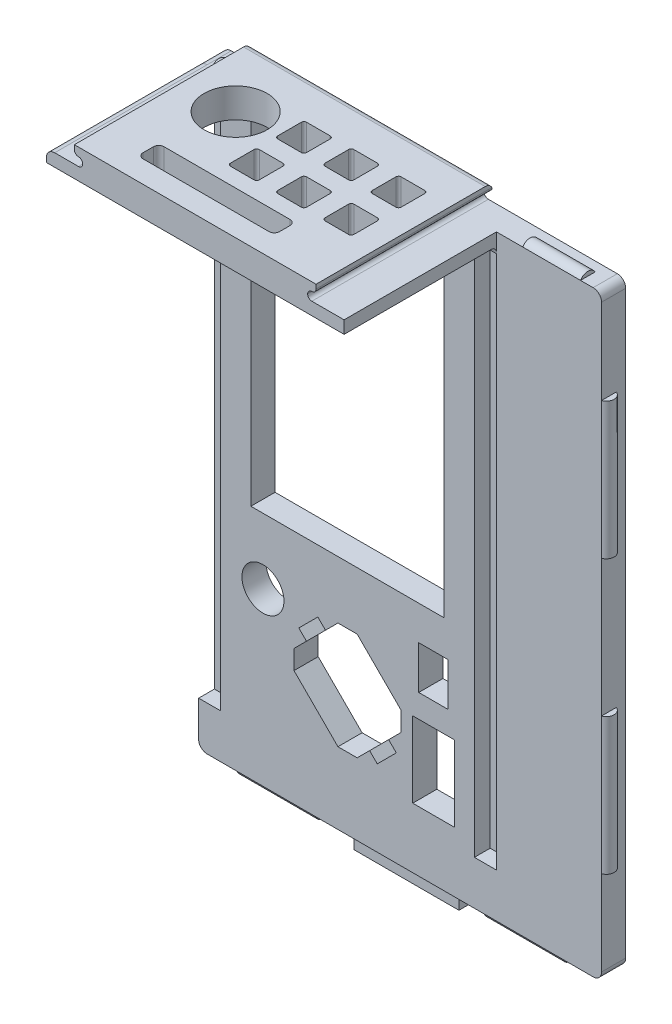
from build123d import *

# Parameters (mm, degrees)
SKETCH_2_W                      = 2.80320188
SKETCH_2_H                      = 4.10319928
SKETCH_2_R                      = 2
SKETCH_2_W_2                    = 3.99999908
SKETCH_2_H_2                    = 7.20319816
EXTRUDE_1_DEPTH                 = 2.3
EXTRUDE_2_DEPTH                 = 14.5
EXTRUDE_2_DEPTH_BACK            = 2.3
SKETCH_3_W                      = 28.34
SKETCH_3_H                      = 3.4
SKETCH_4_R                      = 3
CUT_EXTRUDE_1_DEPTH             = 3.4
SKETCH_2_3_W                    = 2.1
SKETCH_2_3_H                    = 50.8
CUT_EXTRUDE_2_DEPTH             = 1.5
SKETCH_5_W                      = 28.34
SKETCH_5_H                      = 4.2
EXTRUDE_3_DEPTH                 = 2.3
CUT_EXTRUDE_3_REACH             = 71.007
SKETCH_7_W                      = 28.34
SKETCH_7_H                      = 0.6
SKETCH_8_W                      = 13
SKETCH_8_H                      = 2
CUT_EXTRUDE_4_DEPTH             = 2.8
EXTRUDE_5_DEPTH                 = 15.5
EXTRUDE_5_DEPTH_BACK            = 15.5
SKETCH_11_W                     = 3.47
SKETCH_11_H                     = 2.8
CUT_EXTRUDE_5_DEPTH             = 14.5
SKETCH_12_W                     = 3.47
SKETCH_12_H                     = 1.6
SKETCH_12_W_2                   = 13.47
CUT_EXTRUDE_6_DEPTH             = 2.3
EXTRUDE_6_DEPTH                 = 19.5
EXTRUDE_6_DEPTH_BACK            = 19.5
EXTRUDE_7_DEPTH                 = 5.5
EXTRUDE_START                   = -1
EXTRUDE_8_DEPTH                 = 1
FILLET_3_R                      = 0.8
FILLET_4_R                      = 0.5
CUT_EXTRUDE_7_DEPTH             = 6.5
CUT_EXTRUDE_7_DEPTH_BACK        = 6.5
CUT_EXTRUDE_8_DEPTH             = 8
CUT_EXTRUDE_8_DEPTH_BACK        = 8
SKETCH_16_W                     = 10
SKETCH_16_H                     = 1.5
EXTRUDE_9_DEPTH                 = 1.7
FILLET_5_R                      = 0.5
FILLET_6_R                      = 0.5
FILLET_7_R                      = 0.7
SKETCH_18_R                     = 2.4
SKETCH_18_R_2                   = 1.92
SKETCH_18_W                     = 1.228272528
SKETCH_18_H                     = 1.583492732
CUT_EXTRUDE_9_DEPTH             = 0.3
SKETCH_19_W                     = 0.8
SKETCH_19_H                     = 0.8
EXTRUDE_10_DEPTH                = 16.8
FILLET_2_R                      = 0.7
FILLET_8_R                      = 0.4
SKETCH_21_W                     = 3.47
SKETCH_21_H                     = 1.2
EXTRUDE_12_DEPTH                = 14.5
FILLET_10_R                     = 0.4
FILLET_11_R                     = 0.8
FILLET_12_R                     = 0.5
SKETCH_22_W                     = 2.75
SKETCH_22_H                     = 2.75
CUT_EXTRUDE_10_DEPTH            = 2.8
FILLET_13_R                     = 0.25
PATTERN_LINEAR_1_COUNT          = 3
PATTERN_LINEAR_1_PITCH          = 4.5
PATTERN_LINEAR_1_COUNT_DIR2     = 2
PATTERN_LINEAR_1_PITCH_DIR2     = 4.5
FILLET_13_OF_PATTERN_LINEAR_1_R = 0.25
CUT_EXTRUDE_11_DEPTH            = 0.3
FILLET_14_R                     = 0.4


with BuildPart() as part:
    # 草图2 → 凸台-拉伸1 (new body)
    with BuildSketch(Plane.XY):
        Polygon((-0.2, 0), (-0.2, -50.8), (28.14, -50.8), (28.14, 0), (23.17, 0), (23.17, -32.5), (4.77, -32.5), (4.77, 0), align=None)
        with Locations((22.14500143, -37.80800287)):
            Rectangle(SKETCH_2_W, SKETCH_2_H, mode=Mode.SUBTRACT)
        with Locations((5.9182, -38.735)):
            Circle(SKETCH_2_R, mode=Mode.SUBTRACT)
        Polygon((19.066193866, -43.992617401), (17.88030086, -45.178511502), (18.608616214, -45.906826856), (16.798423264, -47.717019806), (16.070108746, -46.988705288), (14.884217409, -48.174597721), (13.055787589, -48.174595399), (8.873804338, -43.992612148), (8.873804338, -42.164191444), (10.05969962, -40.978296162), (9.331380194, -40.249976736), (11.141573144, -38.439783786), (11.86989257, -39.168103212), (13.055787589, -37.982208193), (14.884217273, -37.982205871), (19.066193866, -42.164182464), align=None, mode=Mode.SUBTRACT)
        with Locations((22.16999884, -45.67000137)):
            Rectangle(SKETCH_2_W_2, SKETCH_2_H_2, mode=Mode.SUBTRACT)
    extrude(amount=-EXTRUDE_1_DEPTH)

    # 草图3 → 凸台-拉伸2 (add, two sides: drawn at the far end of the back side and taken through both)
    with BuildSketch(Plane.XY.offset(-EXTRUDE_2_DEPTH_BACK)):
        with Locations((13.97, 1.7)):
            Rectangle(SKETCH_3_W, SKETCH_3_H)
    extrude(amount=EXTRUDE_2_DEPTH + EXTRUDE_2_DEPTH_BACK)

    # 草图4 → 切除-拉伸1 (cut)
    with BuildSketch(Plane(origin=(0, 3.4, 0), x_dir=(1, 0, 0), z_dir=(0, 1, 0))):
        with Locations(Location((7.41680127, -4.1, 0), (0, 0, 270))):
            Circle(SKETCH_4_R)
    extrude(amount=-CUT_EXTRUDE_1_DEPTH, mode=Mode.SUBTRACT)

    # 草图2<3> → 切除-拉伸2 (cut)
    with BuildSketch(Plane.XY):
        with Locations((0.85, -25.4)):
            Rectangle(SKETCH_2_3_W, SKETCH_2_3_H)
        with Locations((27.09, -25.4)):
            Rectangle(SKETCH_2_3_W, SKETCH_2_3_H)
    extrude(amount=-CUT_EXTRUDE_2_DEPTH, mode=Mode.SUBTRACT)

    # 草图5 → 凸台-拉伸3 (add)
    with BuildSketch(Plane.XY):
        Polygon((28.14, 3.4), (28.14, -50.8), (28.14, -55), (38.14, -55), (38.14, 3.4), align=None)
        with Locations((13.97, -52.9)):
            Rectangle(SKETCH_5_W, SKETCH_5_H)
    extrude(amount=-EXTRUDE_3_DEPTH)

    # 切除-拉伸3: up to this face of the body (flat: up to its plane)
    cut_extrude_3_end = Plane(part.part.faces().sort_by_distance((13.97, -33.198606871, 0))[0])
    # 草图7 → 切除-拉伸3 (cut, up to the picked face)
    with BuildSketch(Plane.XY.offset(14.5), mode=Mode.PRIVATE) as cut_extrude_3_sk1:
        with Locations((13.97, 0.3)):
            Rectangle(SKETCH_7_W, SKETCH_7_H)
    cut_extrude_3_tool1 = split(extrude(cut_extrude_3_sk1.sketch, amount=-CUT_EXTRUDE_3_REACH, mode=Mode.PRIVATE), bisect_by=cut_extrude_3_end, keep=Keep.BOTH, mode=Mode.PRIVATE)
    add(cut_extrude_3_tool1.solids().sort_by(Axis((13.97, 0.3, 14.5), (0, 0, -1)))[0], mode=Mode.SUBTRACT)

    # 草图8 → 切除-拉伸4 (cut)
    with BuildSketch(Plane.XZ.offset(-0.6)):
        with Locations((12.9, 11.4)):
            Rectangle(SKETCH_8_W, SKETCH_8_H)
    extrude(amount=-CUT_EXTRUDE_4_DEPTH, mode=Mode.SUBTRACT)

    # 草图9 → 凸台-拉伸5 (add, two sides: drawn at the far end of the back side and taken through both)
    with BuildSketch(Plane(origin=(18.97, 0, 0), x_dir=(0, 0, -1), z_dir=(1, 0, 0)).offset(-EXTRUDE_5_DEPTH_BACK)):
        with BuildLine():
            ThreePointArc((1.4, -55), (0.7, -55.5), (0, -55))
            Line((0, -55), (1.4, -55))
        make_face()
    extrude(amount=EXTRUDE_5_DEPTH + EXTRUDE_5_DEPTH_BACK)

    # 草图11 → 切除-拉伸5 (cut)
    with BuildSketch(Plane.XY.offset(14.5)):
        with Locations((1.535, 2)):
            Rectangle(SKETCH_11_W, SKETCH_11_H)
        with Locations((26.405, 2)):
            Rectangle(SKETCH_11_W, SKETCH_11_H)
    extrude(amount=-CUT_EXTRUDE_5_DEPTH, mode=Mode.SUBTRACT)

    # 草图12 → 切除-拉伸6 (cut)
    with BuildSketch(Plane(origin=(0, 0, -2.3), x_dir=(-1, 0, 0), z_dir=(0, 0, -1))):
        with Locations((-1.535, 2.6)):
            Rectangle(SKETCH_12_W, SKETCH_12_H)
        with Locations((-31.405, 2.6)):
            Rectangle(SKETCH_12_W_2, SKETCH_12_H)
    extrude(amount=-CUT_EXTRUDE_6_DEPTH, mode=Mode.SUBTRACT)

    # 草图10 → 凸台-拉伸6 (add, two sides: drawn at the far end of the back side and taken through both)
    with BuildSketch(Plane(origin=(0, -26.6, 0), x_dir=(1, 0, 0), z_dir=(0, 1, 0)).offset(-EXTRUDE_6_DEPTH_BACK)):
        with BuildLine():
            Line((38.14, 1.4), (38.14, 0))
            ThreePointArc((38.14, 0), (38.64, 0.7), (38.14, 1.4))
        make_face()
    extrude(amount=EXTRUDE_6_DEPTH + EXTRUDE_6_DEPTH_BACK)

    # 草图14 → 凸台-拉伸7 (add)
    with BuildSketch(Plane(origin=(36.14, 0, 0), x_dir=(0, 0, -1), z_dir=(1, 0, 0))):
        with BuildLine():
            Line((0, 1.8), (1.4, 1.8))
            ThreePointArc((1.4, 1.8), (0.7, 2.2), (0, 1.8))
        make_face()
    extrude(amount=-EXTRUDE_7_DEPTH)

    # 草图15 → 凸台-拉伸8 (add)
    with BuildSketch(Plane.ZY.offset(-1.05).offset(EXTRUDE_START)):
        with BuildLine():
            Line((-1.4, 1.8), (0, 1.8))
            ThreePointArc((0, 1.8), (-0.7, 2.2), (-1.4, 1.8))
        make_face()
    extrude(amount=EXTRUDE_8_DEPTH)

    # 圆角3
    fillet_3_edges = [part.edges().sort_by_distance(p)[0] for p in [
        (-0.2, -55, -1.15),
        (38.14, -55, -1.15),
        (-0.2, 1.8, -1.15),
        (38.14, 1.8, -1.15),
    ]]
    fillet(fillet_3_edges, radius=FILLET_3_R)

    # 圆角4
    fillet_4_edges = [part.edges().sort_by_distance(p)[0] for p in [
        (19.4, 2, 10.4),
        (19.4, 2, 12.4),
        (6.4, 2, 12.4),
        (6.4, 2, 10.4),
    ]]
    fillet(fillet_4_edges, radius=FILLET_4_R)

    # 草图10<2> → 切除-拉伸7 (cut, two sides: drawn at the far end of the back side and taken through both)
    with BuildSketch(Plane(origin=(0, -26.6, 0), x_dir=(1, 0, 0), z_dir=(0, 1, 0)).offset(-CUT_EXTRUDE_7_DEPTH_BACK)):
        with BuildLine():
            Line((38.14, 1.4), (38.14, 0))
            ThreePointArc((38.14, 0), (38.64, 0.7), (38.14, 1.4))
        make_face()
    extrude(amount=CUT_EXTRUDE_7_DEPTH + CUT_EXTRUDE_7_DEPTH_BACK, mode=Mode.SUBTRACT)

    # 草图9<3> → 切除-拉伸8 (cut, two sides: drawn at the far end of the back side and taken through both)
    with BuildSketch(Plane(origin=(18.97, 0, 0), x_dir=(0, 0, -1), z_dir=(1, 0, 0)).offset(-CUT_EXTRUDE_8_DEPTH_BACK)):
        with BuildLine():
            Line((0, -55), (1.4, -55))
            ThreePointArc((1.4, -55), (0.7, -55.5), (0, -55))
        make_face()
    extrude(amount=CUT_EXTRUDE_8_DEPTH + CUT_EXTRUDE_8_DEPTH_BACK, mode=Mode.SUBTRACT)

    # 草图16 → 凸台-拉伸9 (add)
    with BuildSketch(Plane(origin=(0, 0, -2.3), x_dir=(-1, 0, 0), z_dir=(0, 0, -1))):
        with Locations((-18.97, -55.75)):
            Rectangle(SKETCH_16_W, SKETCH_16_H)
    extrude(amount=-EXTRUDE_9_DEPTH)

    # 圆角5
    fillet_5_edges = [part.edges().sort_by_distance(p)[0] for p in [
        (18.97, -55, -0.6),
    ]]
    fillet(fillet_5_edges, radius=FILLET_5_R)

    # 圆角6
    fillet_6_edges = [part.edges().sort_by_distance(p)[0] for p in [
        (13.97, -55, -1.2),
        (23.97, -55, -1.2),
    ]]
    fillet(fillet_6_edges, radius=FILLET_6_R)

    # 圆角7
    fillet_7_edges = [part.edges().sort_by_distance(p)[0] for p in [
        (18.97, -56.5, -2.3),
    ]]
    fillet(fillet_7_edges, radius=FILLET_7_R)

    # 草图18 → 切除-拉伸9 (cut)
    # profile 1 of 13: a face of its own
    with BuildSketch(Plane(origin=(0, 0, -2.3), x_dir=(-1, 0, 0), z_dir=(0, 0, -1))):
        with Locations((-29.127267398, -16.25)):
            Circle(SKETCH_18_R)
        with Locations((-29.127267398, -16.25)):
            Circle(SKETCH_18_R_2, mode=Mode.SUBTRACT)
    # profile 2 of 13: a face of its own
    with BuildSketch(Plane(origin=(0, 0, -2.3), x_dir=(-1, 0, 0), z_dir=(0, 0, -1))):
        with BuildLine():
            Line((-24.995537207, -11.915295158), (-26.327515915, -15.57487658))
            ThreePointArc((-26.327515915, -15.57487658), (-26.18407452, -15.882487643), (-25.876463457, -15.739046249))
            Line((-25.876463457, -15.739046249), (-24.544484749, -12.079464827))
            ThreePointArc((-24.544484749, -12.079464827), (-24.687926144, -11.771853763), (-24.995537207, -11.915295158))
        make_face()
    # profile 3 of 13: a face of its own
    with BuildSketch(Plane(origin=(0, 0, -2.3), x_dir=(-1, 0, 0), z_dir=(0, 0, -1))):
        with BuildLine():
            Line((-33.46197224, -12.118269809), (-29.802390818, -13.450248517))
            ThreePointArc((-29.802390818, -13.450248517), (-29.494779755, -13.306807122), (-29.638221149, -12.999196059))
            Line((-29.638221149, -12.999196059), (-33.297802571, -11.667217351))
            ThreePointArc((-33.297802571, -11.667217351), (-33.605413635, -11.810658746), (-33.46197224, -12.118269809))
        make_face()
    # profile 4 of 13: a face of its own
    with BuildSketch(Plane(origin=(0, 0, -2.3), x_dir=(-1, 0, 0), z_dir=(0, 0, -1))):
        with BuildLine():
            Line((-33.258997589, -20.584704842), (-31.927018881, -16.92512342))
            ThreePointArc((-31.927018881, -16.92512342), (-32.070460276, -16.617512357), (-32.378071339, -16.760953751))
            Line((-32.378071339, -16.760953751), (-33.710050047, -20.420535173))
            ThreePointArc((-33.710050047, -20.420535173), (-33.566608652, -20.728146237), (-33.258997589, -20.584704842))
        make_face()
    # profile 5 of 13: a face of its own
    with BuildSketch(Plane(origin=(0, 0, -2.3), x_dir=(-1, 0, 0), z_dir=(0, 0, -1))):
        with BuildLine():
            Line((-24.792562556, -20.381730191), (-28.452143978, -19.049751483))
            ThreePointArc((-28.452143978, -19.049751483), (-28.759755042, -19.193192878), (-28.616313647, -19.500803941))
            Line((-28.616313647, -19.500803941), (-24.956732225, -20.832782649))
            ThreePointArc((-24.956732225, -20.832782649), (-24.649121162, -20.689341254), (-24.792562556, -20.381730191))
        make_face()
    # profile 6 of 13: a face of its own
    with BuildSketch(Plane(origin=(0, 0, -2.3), x_dir=(-1, 0, 0), z_dir=(0, 0, -1))):
        Polygon((-34.774448204, -25.776760243), (-36.74, -25.776760243), (-36.74, -27.909660224), (-36.372149744, -27.909660224), (-36.372149744, -26.259859721), (-35.889050267, -26.259859721), (-35.889050267, -27.205534842), (-35.549617627, -27.205534842), (-35.549617627, -26.259859721), (-35.121774626, -26.259859721), (-35.121774626, -27.884400121), (-34.774448204, -27.884400121), align=None)
    # profile 7 of 13: a face of its own
    with BuildSketch(Plane(origin=(0, 0, -2.3), x_dir=(-1, 0, 0), z_dir=(0, 0, -1))):
        Polygon((-34.774448204, -24.730044708), (-36.20006529, -23.945402746), (-34.774448204, -23.111819334), (-34.774448204, -22.570305867), (-36.74, -23.759109484), (-36.74, -24.087490828), (-34.774448204, -25.227352994), align=None)
    # profile 8 of 13: a face of its own
    with BuildSketch(Plane(origin=(0, 0, -2.3), x_dir=(-1, 0, 0), z_dir=(0, 0, -1))):
        Polygon((-35.237023847, -19.469628175), (-36.274266843, -19.469628175), (-36.364255962, -19.472785687), (-36.533182903, -19.505939573), (-36.642117099, -19.573826101), (-36.683164767, -19.635397603), (-36.725791192, -19.779064441), (-36.74, -19.981145268), (-36.74, -21.501487742), (-36.733684974, -21.632524528), (-36.702109845, -21.798293957), (-36.642117099, -21.907228153), (-36.602648188, -21.940382039), (-36.468453888, -21.994059758), (-36.274266843, -22.01142608), (-35.237023847, -22.01142608), (-35.151770998, -22.008268567), (-34.9812653, -21.976693437), (-34.870752348, -21.908806909), (-34.82970468, -21.847235407), (-34.787078256, -21.703568569), (-34.774448204, -21.501487742), (-34.774448204, -19.981145268), (-34.779184473, -19.848529726), (-34.810759603, -19.682760297), (-34.870752348, -19.573826101), (-34.91022126, -19.542250972), (-35.044415559, -19.488573252), align=None)
        with Locations((-35.748540941, -20.741316505)):
            Rectangle(SKETCH_18_W, SKETCH_18_H, mode=Mode.SUBTRACT)
    # profile 9 of 13: a face of its own
    with BuildSketch(Plane(origin=(0, 0, -2.3), x_dir=(-1, 0, 0), z_dir=(0, 0, -1))):
        Polygon((-34.774448204, -18.206623004), (-36.078501042, -18.206623004), (-34.774448204, -16.537877423), (-34.774448204, -16.209496079), (-36.74, -16.209496079), (-36.74, -16.645232863), (-35.413844571, -16.645232863), (-36.74, -18.307663418), (-36.74, -18.639202275), (-34.774448204, -18.639202275), align=None)
    # profile 10 of 13: a face of its own
    with BuildSketch(Plane(origin=(0, 0, -2.3), x_dir=(-1, 0, 0), z_dir=(0, 0, -1))):
        Polygon((-34.774448204, -13.383522011), (-36.74, -13.383522011), (-36.74, -15.518000748), (-36.372149744, -15.518000748), (-36.372149744, -13.868200245), (-35.889050267, -13.868200245), (-35.889050267, -14.813875366), (-35.549617627, -14.813875366), (-35.549617627, -13.868200245), (-35.121774626, -13.868200245), (-35.121774626, -15.492740645), (-34.774448204, -15.492740645), align=None)
    # profile 11 of 13: a face of its own
    with BuildSketch(Plane(origin=(0, 0, -2.3), x_dir=(-1, 0, 0), z_dir=(0, 0, -1))):
        Polygon((-34.774448204, -10.559126699), (-36.74, -10.559126699), (-36.74, -12.69202668), (-36.372149744, -12.69202668), (-36.372149744, -11.042226176), (-35.889050267, -11.042226176), (-35.889050267, -11.989480054), (-35.549617627, -11.989480054), (-35.549617627, -11.042226176), (-35.121774626, -11.042226176), (-35.121774626, -12.666766577), (-34.774448204, -12.666766577), align=None)
    # profile 12 of 13: a face of its own
    with BuildSketch(Plane(origin=(0, 0, -2.3), x_dir=(-1, 0, 0), z_dir=(0, 0, -1))):
        Polygon((-36.74, -9.28664899), (-36.74, -9.973408051), (-35.99482695, -9.038784225), (-35.99482695, -9.30875158), (-35.993248193, -9.364008056), (-35.96798809, -9.537671267), (-35.906416588, -9.660814271), (-35.791167366, -9.741330851), (-35.619082911, -9.769748467), (-35.154928511, -9.769748467), (-35.153349755, -9.769748467), (-34.979686544, -9.741330851), (-34.862858566, -9.660814271), (-34.842334732, -9.632396655), (-34.790235769, -9.496623599), (-34.774448204, -9.30875158), (-34.774448204, -7.538965585), (-36.74, -7.538965585), (-36.74, -8.011013768), (-35.99482695, -8.011013768), (-35.99482695, -8.462538116), align=None)
        Polygon((-35.112302087, -9.125615831), (-35.148613486, -9.277176451), (-35.270177733, -9.322960388), (-35.497518664, -9.322960388), (-35.620661668, -9.277176451), (-35.626976694, -9.267703912), (-35.656973067, -9.105091997), (-35.656973067, -8.011013768), (-35.112302087, -8.011013768), align=None, mode=Mode.SUBTRACT)
    # profile 13 of 13: a face of its own
    with BuildSketch(Plane(origin=(0, 0, -2.3), x_dir=(-1, 0, 0), z_dir=(0, 0, -1))):
        Polygon((-34.340290177, -4.596163539), (-36.74, -4.596163539), (-36.74, -5.15346457), (-35.829057521, -5.15346457), (-35.829057521, -6.163868706), (-35.391741981, -6.163868706), (-35.391741981, -5.15346457), (-34.760239396, -5.15346457), (-34.760239396, -7.021133466), (-34.340290177, -7.021133466), align=None)
    extrude(amount=-CUT_EXTRUDE_9_DEPTH, mode=Mode.SUBTRACT)

    # 草图19 → 凸台-拉伸10 (add)
    with BuildSketch(Plane(origin=(0, 0, -2.3), x_dir=(-1, 0, 0), z_dir=(0, 0, -1))):
        with Locations((-2.87, 3)):
            Rectangle(SKETCH_19_W, SKETCH_19_H)
        with Locations((-25.07, 3)):
            Rectangle(SKETCH_19_W, SKETCH_19_H)
    extrude(amount=-EXTRUDE_10_DEPTH)

    # 圆角2
    fillet_2_edges = [part.edges().sort_by_distance(p)[0] for p in [
        (13.97, 3.4, -2.3),
    ]]
    fillet(fillet_2_edges, radius=FILLET_2_R)

    # 圆角8
    fillet_8_edges = [part.edges().sort_by_distance(p)[0] for p in [
        (24.67, 2.6, 6.1),
        (3.27, 2.6, 6.1),
        (2.47, 2.6, 6.1),
        (25.47, 2.6, 6.1),
    ]]
    fillet(fillet_8_edges, radius=FILLET_8_R - 0.0001)  # a hair under: the kernel refuses the full size

    # 草图21 → 凸台-拉伸12 (add)
    with BuildSketch(Plane.XY.offset(14.5)):
        with Locations((1.535, 1.2)):
            Rectangle(SKETCH_21_W, SKETCH_21_H)
        with Locations((26.405, 1.2)):
            Rectangle(SKETCH_21_W, SKETCH_21_H)
    extrude(amount=-EXTRUDE_12_DEPTH)

    # 圆角10
    fillet_10_edges = [part.edges().sort_by_distance(p)[0] for p in [
        (3.27, 1.8, 6.1),
        (24.67, 1.8, 6.1),
    ]]
    fillet(fillet_10_edges, radius=FILLET_10_R)

    # 圆角11
    fillet_11_edges = [part.edges().sort_by_distance(p)[0] for p in [
        (-0.2, 1.8, 7.25),
    ]]
    fillet(fillet_11_edges, radius=FILLET_11_R)

    # 圆角12
    fillet_12_edges = [part.edges().sort_by_distance(p)[0] for p in [
        (13.97, 0.6, 0),
    ]]
    fillet(fillet_12_edges, radius=FILLET_12_R)

    # 草图22 → 切除-拉伸10 (cut)
    with BuildSketch(Plane(origin=(0, 3.4, 0), x_dir=(1, 0, 0), z_dir=(0, 1, 0))):
        with Locations((21.795, -2.975)):
            Rectangle(SKETCH_22_W, SKETCH_22_H)
    cut_extrude_10 = extrude(amount=-CUT_EXTRUDE_10_DEPTH, mode=Mode.SUBTRACT)

    # 圆角13
    fillet_13_edges = [part.edges().sort_by_distance(p)[0] for p in [
        (20.42, 2, 4.35),
        (20.42, 2, 1.6),
        (23.17, 2, 1.6),
        (23.17, 2, 4.35),
    ]]
    fillet(fillet_13_edges, radius=FILLET_13_R)

    # 阵列(线性)1: Cut-Extrude 10 3 × 2
    with Locations(*[(-i * PATTERN_LINEAR_1_PITCH, 0, j * PATTERN_LINEAR_1_PITCH_DIR2) for i in range(PATTERN_LINEAR_1_COUNT) for j in range(PATTERN_LINEAR_1_COUNT_DIR2) if (i, j) != (0, 0)]):
        add(cut_extrude_10, mode=Mode.SUBTRACT)

    # 圆角13 of 阵列(线性)1
    fillet_13_of_pattern_linear_1_edges = [part.edges().sort_by_distance(p)[0] for p in [
        (20.42, 2, 8.85),
        (20.42, 2, 6.1),
        (23.17, 2, 6.1),
        (23.17, 2, 8.85),
        (15.92, 2, 4.35),
        (15.92, 2, 1.6),
        (18.67, 2, 1.6),
        (18.67, 2, 4.35),
        (15.92, 2, 8.85),
        (15.92, 2, 6.1),
        (18.67, 2, 6.1),
        (18.67, 2, 8.85),
        (11.42, 2, 4.35),
        (11.42, 2, 1.6),
        (14.17, 2, 1.6),
        (14.17, 2, 4.35),
        (11.42, 2, 8.85),
        (11.42, 2, 6.1),
        (14.17, 2, 6.1),
        (14.17, 2, 8.85),
    ]]
    fillet(fillet_13_of_pattern_linear_1_edges, radius=FILLET_13_OF_PATTERN_LINEAR_1_R)

    # 草图23 → 切除-拉伸11 (cut)
    with BuildSketch(Plane(origin=(0, 0, -2.3), x_dir=(-1, 0, 0), z_dir=(0, 0, -1))):
        with BuildLine():
            Line((-21.109338668, -51.475140053), (-20.543653243, -50.909454628))
            ThreePointArc((-20.543653243, -50.909454628), (-24.46999884, -52.535800225), (-20.543653243, -54.162145822))
            Line((-20.543653243, -54.162145822), (-21.109338668, -53.596460397))
            ThreePointArc((-21.109338668, -53.596460397), (-23.66999884, -52.535800225), (-21.109338668, -51.475140053))
        make_face()
        with BuildLine():
            Line((-22.16999884, -52.135800225), (-20.16999884, -52.135800225))
            ThreePointArc((-20.16999884, -52.135800225), (-19.76999884, -52.535800225), (-20.16999884, -52.935800225))
            Line((-20.16999884, -52.935800225), (-22.16999884, -52.935800225))
            ThreePointArc((-22.16999884, -52.935800225), (-22.56999884, -52.535800225), (-22.16999884, -52.135800225))
        make_face()
    extrude(amount=-CUT_EXTRUDE_11_DEPTH, mode=Mode.SUBTRACT)

    # 圆角14
    fillet_14_edges = [part.edges().sort_by_distance(p)[0] for p in [
        (20.543653243, -50.909454628, -2.15),
        (21.109338668, -51.475140053, -2.15),
        (21.109338668, -53.596460397, -2.15),
        (20.543653243, -54.162145822, -2.15),
    ]]
    fillet(fillet_14_edges, radius=FILLET_14_R - 0.0001)  # a hair under: the kernel refuses the full size


solid = part.part
